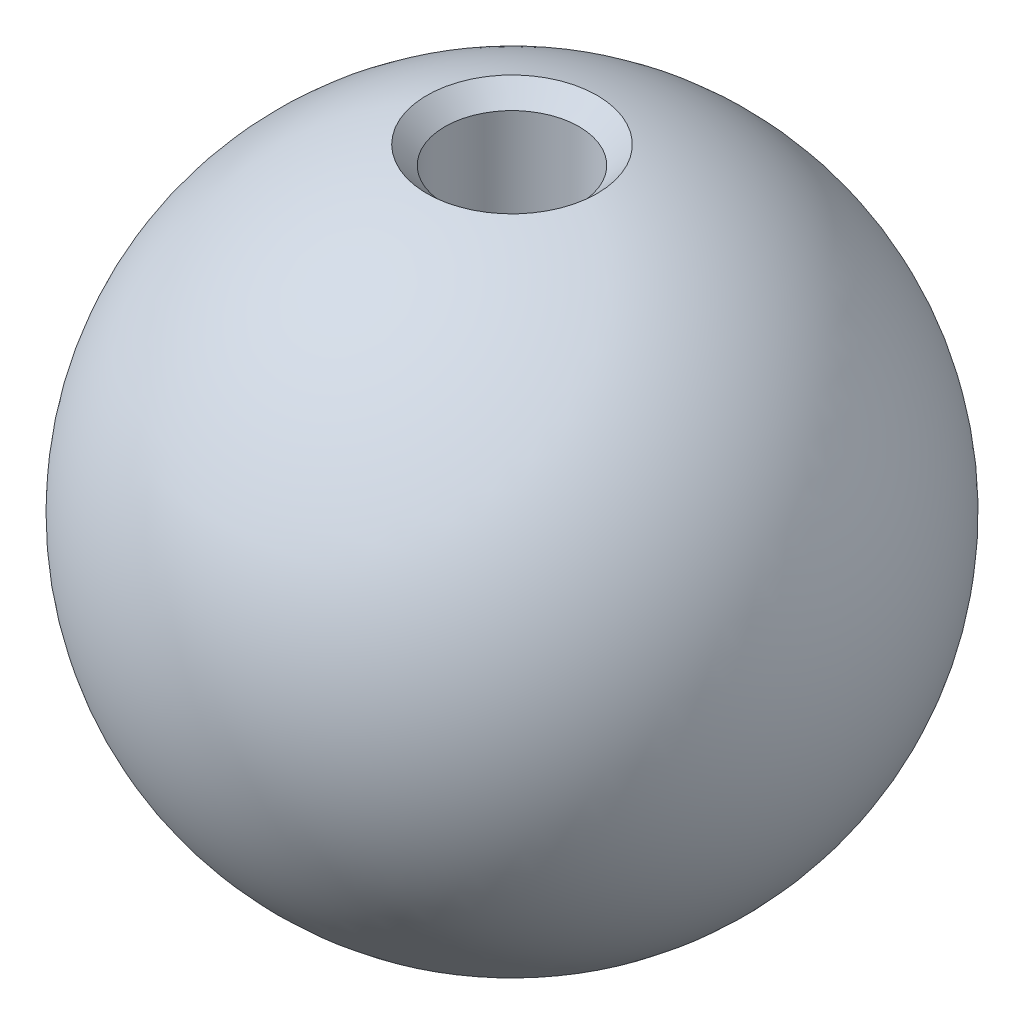
from build123d import *
from build123d.topology import SkipClean

# Parameters (mm, degrees)
IZIM2_R               = 3
KES_EKSTR_ZYON1_DEPTH = 20
PAH1_SIZE             = 1
PAH2_SIZE             = 1


with BuildPart() as part:
    # Çizim1 → Döndür2 (revolve)
    with SkipClean():  # the faces are left unmerged after this step: merging them gives an invalid solid
        with BuildSketch(Plane.XY):
            with BuildLine():
                ThreePointArc((14.75, 0), (10.429825023, 10.429825023), (0, 14.75))
                Line((0, 14.75), (0, -14.75))
                ThreePointArc((0, -14.75), (10.429825023, -10.429825023), (14.75, 0))
            make_face()
            with BuildLine():
                Line((0, -14.75), (0, 14.75))
                ThreePointArc((0, 14.75), (-14.75, 0), (0, -14.75))
            make_face()
        revolve(axis=Axis((0, 19.521191609, 0), (0, -1, 0)))

    # Çizim2 → Kes-Ekstrüzyon1 (cut)
    with BuildSketch(Plane(origin=(0, 14.75, 0), x_dir=(1, 0, 0), z_dir=(0, 1, 0))):
        with Locations(Location((0, 0, 0), (0, 0, 270))):
            Circle(IZIM2_R)
    extrude(amount=-KES_EKSTR_ZYON1_DEPTH, mode=Mode.SUBTRACT)

    # Pah1
    # the kernel refuses this chamfer: 1, 0.845674781 mm, written as the material it takes off along each edge
    with BuildSketch(Plane(origin=(0, 14.441693114, 0), x_dir=(0, 0, 1), z_dir=(1, 0, 0))) as pah1_piece_1:
        with BuildLine():
            Line((3.808218247, 0.191781753), (3, PAH1_SIZE))
            Line((3, PAH1_SIZE), (3, 0))
            ThreePointArc((3, 0), (3.415662232, 0.092625147), (3.808218247, 0.191781753))
        make_face()
    revolve(axis=Axis((0, 14.441693114, 0), (0, -1, 0)), revolution_arc=270, mode=Mode.SUBTRACT)
    with BuildSketch(Plane(origin=(0, 14.441693114, 0), x_dir=(0, 0, 1), z_dir=(-1, 0, 0))) as pah1_piece_2:
        with BuildLine():
            Line((3.808218247, -0.191781753), (3, -PAH1_SIZE))
            Line((3, -PAH1_SIZE), (3, 0))
            ThreePointArc((3, 0), (3.415662232, -0.092625147), (3.808218247, -0.191781753))
        make_face()
    revolve(axis=Axis((0, 14.441693114, 0), (0, 1, 0)), revolution_arc=90, mode=Mode.SUBTRACT)

    # Pah2
    pah2_edges = [part.edges().sort_by_distance(p)[0] for p in [
        (0, -5.25, -3),
    ]]
    chamfer(pah2_edges, length=PAH2_SIZE)


solid = part.part
